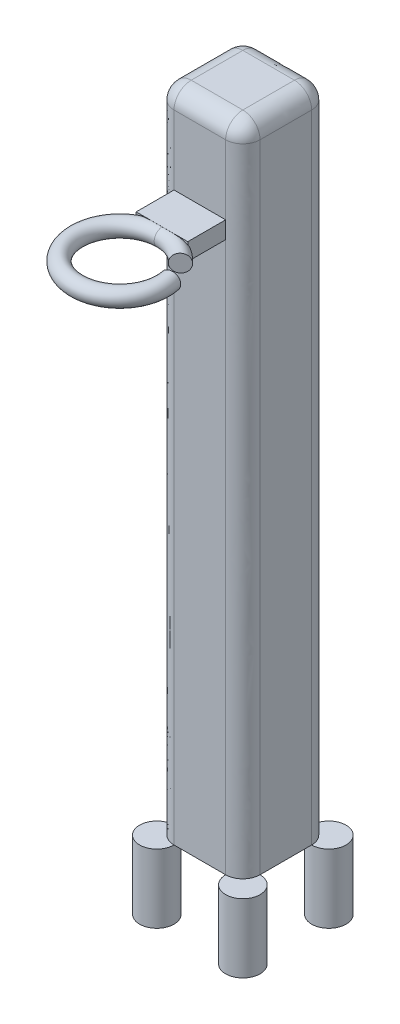
from build123d import *

# Parameters (mm, degrees)
SKETCH_1_W          = 50
SKETCH_1_H          = 50
EXTRUDE_1_DEPTH     = 380
FILLET_1_R          = 10
FILLET_2_R          = 10
SKETCH_2_R          = 10
EXTRUDE_5_DEPTH     = 39.9
SKETCH_14_R         = 5
SKETCH_15_W         = 30
SKETCH_15_H         = 10
EXTRUDE_7_DEPTH     = 22
CUT_EXTRUDE_1_DEPTH = 11


with BuildPart() as part:
    # 草图1 → 凸台-拉伸1 (new body)
    with BuildSketch(Plane(origin=(0, 0, 0), x_dir=(1, 0, 0), z_dir=(0, 1, 0))):
        Rectangle(SKETCH_1_W, SKETCH_1_H)
    extrude(amount=EXTRUDE_1_DEPTH)

    # 变化圆角1
    fillet_1_edges = [part.edges().sort_by_distance(p)[0] for p in [
        (-25, 380, 0),
        (0, 380, 25),
        (-25, 190, 25),
    ]]
    fillet(fillet_1_edges, radius=FILLET_1_R)

    # 变化圆角2
    fillet_2_edges = [part.edges().sort_by_distance(p)[0] for p in [
        (25, 380, -5),
        (5, 380, -25),
        (25, 190, -25),
        (25, 185, 25),
    ]]
    fillet(fillet_2_edges, radius=FILLET_2_R)

    # 草图2 → 凸台-拉伸5 (add)
    with BuildSketch(Plane(origin=(0, 0, 0), x_dir=(1, 0, 0), z_dir=(0, 1, 0))):
        with Locations((-25, 25)):
            Circle(SKETCH_2_R)
        with Locations((25, 25)):
            Circle(SKETCH_2_R)
        with Locations((-25, -25)):
            Circle(SKETCH_2_R)
        with Locations((25, -25)):
            Circle(SKETCH_2_R)
    extrude(amount=-EXTRUDE_5_DEPTH)



with BuildPart() as body_2:
    # 扫描4: sweep along a path in 草图13
    with BuildLine(Plane(origin=(0, 324.7, 0), x_dir=(1, 0, 0), z_dir=(0, 1, 0))) as sweep_4_path:
        CenterArc((0, -71.548995593), 25, 0, 360)
    # 草图14 → 扫描4 (sweep)
    with BuildSketch(Plane(origin=(0, 0, 0), x_dir=(0, 0, -1), z_dir=(1, 0, 0))):
        with Locations((-46.548995593, 324.7)):
            Circle(SKETCH_14_R)
    sweep(path=sweep_4_path.line)


with BuildPart() as part_1:
    add(part.part)

    add(body_2.part)  # 凸台-拉伸7 merges body 2
    # 草图15 → 凸台-拉伸7 (add)
    with BuildSketch(Plane.XY.offset(25)):
        with Locations((0, 324.721413224)):
            Rectangle(SKETCH_15_W, SKETCH_15_H)
    extrude(amount=EXTRUDE_7_DEPTH)

    # 草图16 → 切除-拉伸1 (cut, symmetric)
    with BuildSketch(Plane(origin=(0, 324.7, 0), x_dir=(1, 0, 0), z_dir=(0, 1, 0))):
        with BuildLine():
            Line((14.92450283, -58.235122554), (22.386754245, -51.578186035))
            ThreePointArc((22.386754245, -51.578186035), (26.800200496, -58.067554521), (29.37960745, -65.479509115))
            Line((29.37960745, -65.479509115), (19.586404966, -67.502671275))
            ThreePointArc((19.586404966, -67.502671275), (17.866800331, -62.561368211), (14.92450283, -58.235122554))
        make_face()
    extrude(amount=CUT_EXTRUDE_1_DEPTH, both=True, mode=Mode.SUBTRACT)


solid = part_1.part
